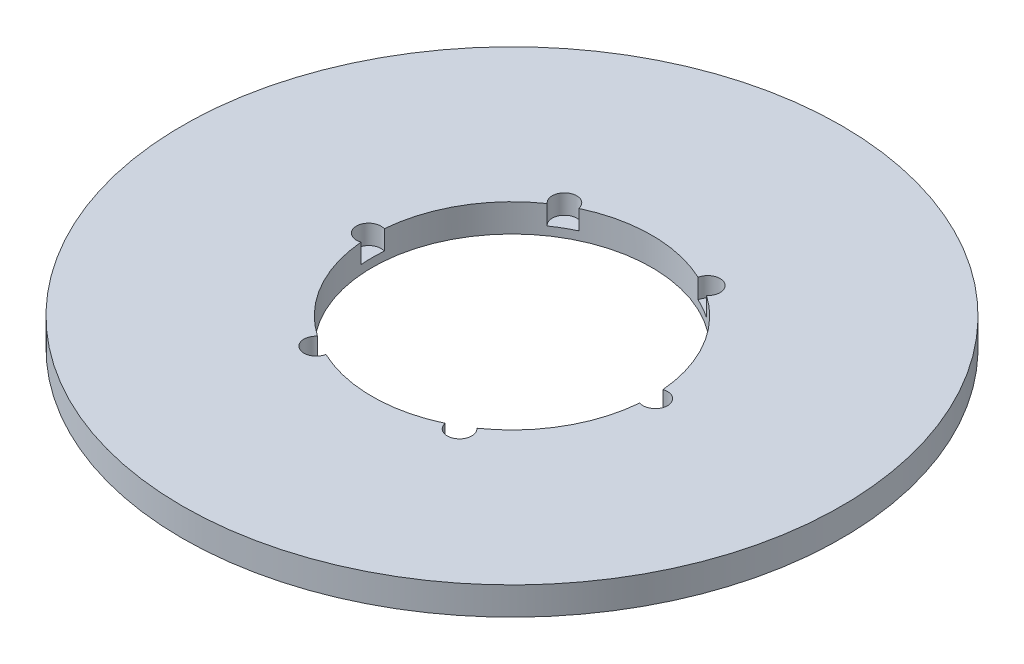
from build123d import *

# Parameters (mm, degrees)
SKETCH1_R           = 82.5
BOSS_EXTRUDE1_DEPTH = 7
SKETCH2_R           = 35
CUT_EXTRUDE1_DEPTH  = 117.882419551
SKETCH3_R           = 3.066958538
CUT_EXTRUDE2_DEPTH  = 4.865165269
CIRPATTERN1_COUNT   = 6


with BuildPart() as part:
    # Sketch1 → Boss-Extrude1 (new body)
    with BuildSketch(Plane(origin=(0, 0, 0), x_dir=(1, 0, 0), z_dir=(0, 1, 0))):
        Circle(SKETCH1_R)
    extrude(amount=BOSS_EXTRUDE1_DEPTH)

    # Sketch2 → Cut-Extrude1 (cut, through all)
    with BuildSketch(Plane(origin=(0, 0, 0), x_dir=(1, 0, 0), z_dir=(0, 1, 0))):
        Circle(SKETCH2_R)
    extrude(amount=CUT_EXTRUDE1_DEPTH, mode=Mode.SUBTRACT)

    # Sketch3 → Cut-Extrude2 (cut)
    with BuildSketch(Plane(origin=(0, 7, 0), x_dir=(1, 0, 0), z_dir=(0, 1, 0))):
        with Locations((-35.878534862, 0)):
            Circle(SKETCH3_R)
    cut_extrude2 = extrude(amount=-CUT_EXTRUDE2_DEPTH, mode=Mode.SUBTRACT)

    # CirPattern1: Cut-Extrude2 ×6 about axis
    cirpattern1_axis = Axis((0, 0, 0), (0, 1, 0))
    for i in range(1, CIRPATTERN1_COUNT):
        add(cut_extrude2.rotate(cirpattern1_axis, i * 360 / CIRPATTERN1_COUNT), mode=Mode.SUBTRACT)


solid = part.part
